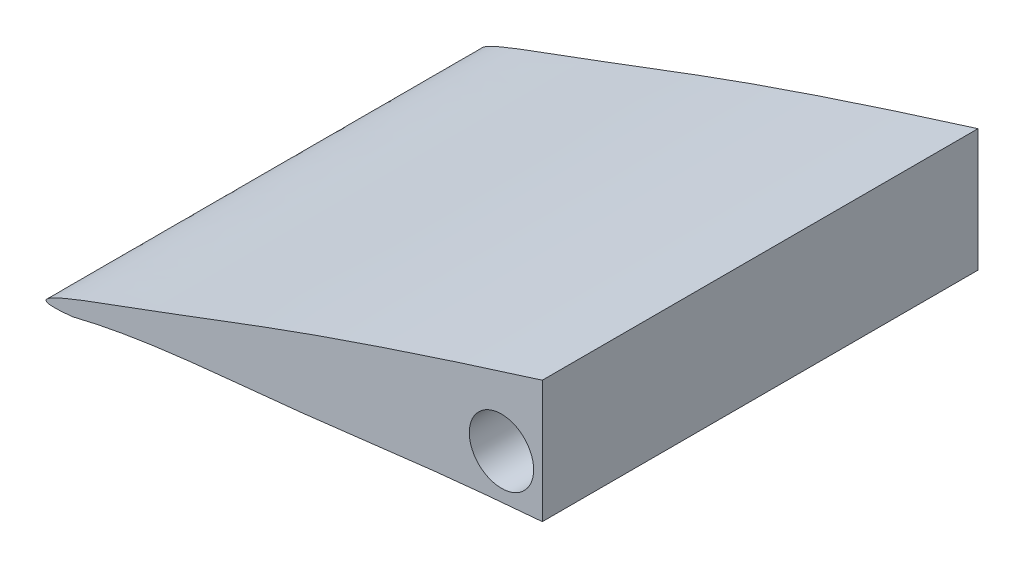
from build123d import *

# Parameters (mm, degrees)
SKETCH1_R           = 2
SKETCH1_R_2         = 2.127
SKETCH1_R_3         = 2.032
BOSS_EXTRUDE1_DEPTH = 27.0764
SKETCH2_W           = 104.732489184
SKETCH2_H           = 32.948386637
CUT_EXTRUDE1_DEPTH  = 27.0764


with BuildPart() as part:
    # Sketch1 → Boss-Extrude1 (new body)
    with BuildSketch(Plane.XY):
        with BuildLine():
            Line((42.918297493, -0.447743106), (42.918297493, 8.263094686))
            ThreePointArc((42.918297493, 8.263094686), (40.994864427, 12.243356636), (36.681098599, 13.209536914))
            add(Edge.make_bspline(
                [(36.681098599, 13.209536914), (19.829765645, 9.267240013), (-2.073589943, 3.844068304), (-31.096466219, -5.545914493), (-39.316765165, -8.806631661), (-49.515556323, -12.495660485), (-45.77248955, -12.10685039)],
                knots=[0.118068853, 0.118068853, 0.118068853, 0.118068853, 0.630725311, 0.824213609, 0.940085477, 1, 1, 1, 1], degree=3))
            add(Edge.make_bspline(
                [(-45.77248955, -12.10685039), (-41.337443699, -10.999265489), (-33.831609628, -10.530043097), (-20.483498257, -8.707547198), (-8.873433654, -8.01917435), (11.524588595, -6.028171323), (26.067321973, -5.659784939), (37.895141959, -5.527425055)],
                knots=[0, 0, 0, 0, 0.144322392, 0.237947652, 0.42712275, 0.512831912, 0.887817721, 0.887817721, 0.887817721, 0.887817721], degree=3))
            ThreePointArc((37.895141959, -5.527425055), (41.450441586, -4.019691462), (42.918297493, -0.447743106))
        make_face()
        with Locations((-19.10248955, -6.01085039)):
            Circle(SKETCH1_R, mode=Mode.SUBTRACT)
        with Locations((12.64751045, 4.40314961)):
            Circle(SKETCH1_R_2, mode=Mode.SUBTRACT)
        with Locations((33.89346968, 3.421717851)):
            Circle(SKETCH1_R_3, mode=Mode.SUBTRACT)
    extrude(amount=BOSS_EXTRUDE1_DEPTH)

    # Sketch2 → Cut-Extrude1 (cut)
    with BuildSketch(Plane.XY.offset(27.0764)):
        with Locations((35.803755042, -2.355433399)):
            Rectangle(SKETCH2_W, SKETCH2_H)
    extrude(amount=-CUT_EXTRUDE1_DEPTH, mode=Mode.SUBTRACT)


solid = part.part
